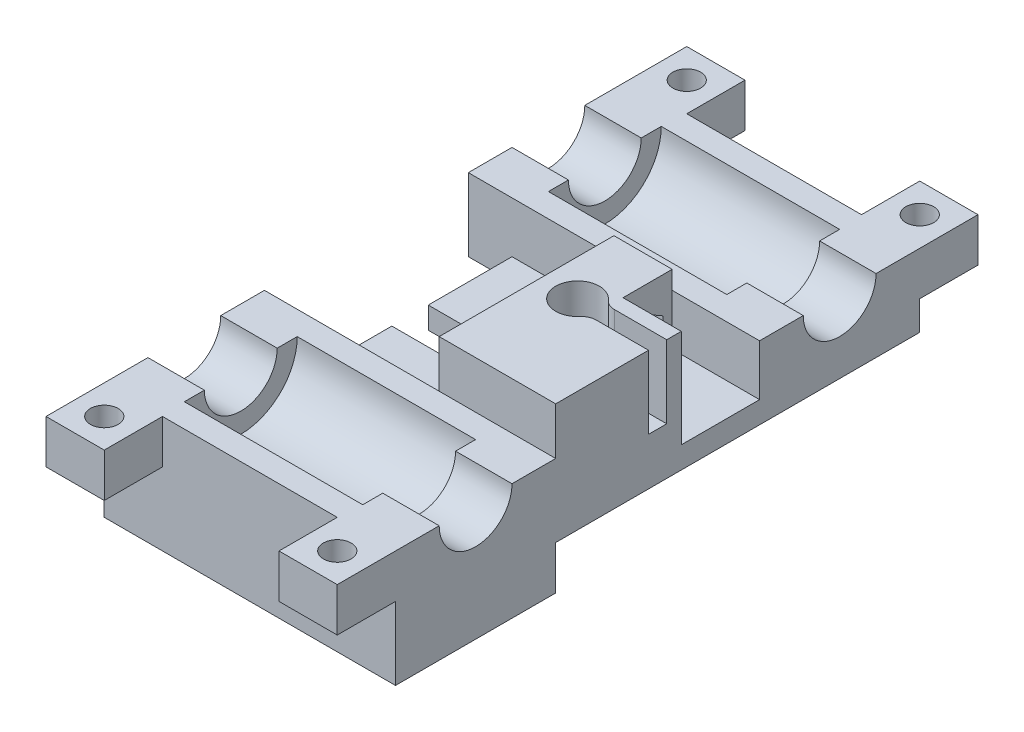
from build123d import *

# Parameters (mm, degrees)
SKETCH1_W                  = 40
SKETCH1_H                  = 22
BOSS_EXTRUDE1_DEPTH        = 11
SKETCH2_W                  = 40
SKETCH2_H                  = 22
SKETCH2_R                  = 4
BOSS_EXTRUDE2_DEPTH        = 5
SKETCH3_W                  = 24.5
SKETCH3_H                  = 15.5
CUT_EXTRUDE1_DEPTH         = 7.75
FILLET1_R                  = 7.75
SKETCH4_R                  = 5
CUT_EXTRUDE2_DEPTH         = 36.805900352
SKETCH5_W                  = 8
SKETCH5_H                  = 8
SKETCH5_R                  = 1.905800151
BOSS_EXTRUDE3_DEPTH        = 6
CUT_EXTRUDE3_START         = -3
SKETCH6_R                  = 3
SKETCH6_R_2                = 1.905800151
CUT_EXTRUDE3_DEPTH         = 3
SKETCH7_W                  = 16
SKETCH7_H                  = 16.5
BOSS_EXTRUDE5_DEPTH        = 28
MIRROR14_COPY_1_SKETCH_W   = 8
MIRROR14_COPY_1_SKETCH_H   = 8
MIRROR14_COPY_1_SKETCH_R   = 1.905800151
MIRROR14_COPY_1_DEPTH      = 6
MIRROR14_START             = -3
MIRROR14_COPY_2_SKETCH_R   = 3
MIRROR14_COPY_2_SKETCH_R_2 = 1.905800151
MIRROR14_COPY_2_DEPTH      = 3
FILLET1_OF_MIRROR14_R      = 7.75
SKETCH9_W                  = 28
SKETCH9_H                  = 3
BOSS_EXTRUDE6_DEPTH        = 18
CUT_EXTRUDE4_DEPTH         = 10
CUT_EXTRUDE5_DEPTH         = 73.919476136
CUT_EXTRUDE5_DEPTH_BACK    = 73.919476136
SKETCH11_R                 = 1.75
CUT_EXTRUDE6_DEPTH         = 76.121568141
CUT_EXTRUDE6_DEPTH_BACK    = 76.121568141
SKETCH12_R                 = 1.75
FILLET2_R                  = 2
CUT_EXTRUDE12_START        = -3
SKETCH17_R                 = 1.75
CUT_EXTRUDE12_DEPTH        = 3
CUT_EXTRUDE13_DEPTH        = 74.097537578
CUT_EXTRUDE13_DEPTH_BACK   = 74.097537578
SKETCH18_W                 = 18
SKETCH18_H                 = 5
FILLET3_R                  = 2.5
CUT_EXTRUDE14_DEPTH        = 74.710582687
CUT_EXTRUDE15_START        = -10
SKETCH21_R                 = 1.75
CUT_EXTRUDE15_DEPTH        = 10
SKETCH20_W                 = 36.163748027
SKETCH20_H                 = 4
CUT_EXTRUDE16_DEPTH        = 13.5
SKETCH22_W                 = 6.75
SKETCH22_H                 = 13.5
CUT_EXTRUDE18_DEPTH        = 8


with BuildPart() as part:
    # Sketch1 → Boss-Extrude1 (new body)
    with BuildSketch(Plane(origin=(0, 0, 0), x_dir=(1, 0, 0), z_dir=(0, 1, 0))):
        Rectangle(SKETCH1_W, SKETCH1_H)
    boss_extrude1 = extrude(amount=BOSS_EXTRUDE1_DEPTH)

    # Sketch2 → Boss-Extrude2 (add)
    with BuildSketch(Plane(origin=(0, 0, 0), x_dir=(1, 0, 0), z_dir=(0, 1, 0))):
        Rectangle(SKETCH2_W, SKETCH2_H)
        with Locations(Location((0, 0, 0), (0, 0, 270))):
            Circle(SKETCH2_R, mode=Mode.SUBTRACT)
    boss_extrude2 = extrude(amount=-BOSS_EXTRUDE2_DEPTH)

    # Sketch3 → Cut-Extrude1 (cut)
    with BuildSketch(Plane(origin=(0, 11, 0), x_dir=(1, 0, 0), z_dir=(0, 1, 0))):
        Rectangle(SKETCH3_W, SKETCH3_H)
    cut_extrude1 = extrude(amount=-CUT_EXTRUDE1_DEPTH, mode=Mode.SUBTRACT)

    # Fillet1
    fillet1_edges = [part.edges().sort_by_distance(p)[0] for p in [
        (0, 3.25, 7.75),
        (0, 3.25, -7.75),
    ]]
    fillet(fillet1_edges, radius=FILLET1_R - 0.0001)  # a hair under: the kernel refuses the full size

    # Sketch4 → Cut-Extrude2 (cut, symmetric)
    with BuildSketch(Plane(origin=(-12.25, 0, 0), x_dir=(0, 0, -1), z_dir=(1, 0, 0))):
        with Locations((0, 11)):
            Circle(SKETCH4_R)
    cut_extrude2 = extrude(amount=CUT_EXTRUDE2_DEPTH, both=True, mode=Mode.SUBTRACT)

    # Sketch5 → Boss-Extrude3 (add)
    with BuildSketch(Plane(origin=(0, 11, 0), x_dir=(1, 0, 0), z_dir=(0, 1, 0))):
        with Locations((16, -15)):
            Rectangle(SKETCH5_W, SKETCH5_H)
        with Locations(Location((16, -15, 0), (0, 0, 270))):
            Circle(SKETCH5_R, mode=Mode.SUBTRACT)
    boss_extrude3 = extrude(amount=-BOSS_EXTRUDE3_DEPTH)

    # Sketch6 → Cut-Extrude3 (cut)
    with BuildSketch(Plane.XZ.offset(-5).offset(CUT_EXTRUDE3_START)):
        with Locations(Location((16, 15, 0), (0, 0, 270))):
            Circle(SKETCH6_R)
        with Locations(Location((16, 15, 0), (0, 0, 90))):
            Circle(SKETCH6_R_2, mode=Mode.SUBTRACT)
    cut_extrude3 = extrude(amount=CUT_EXTRUDE3_DEPTH, mode=Mode.SUBTRACT)

    # Mirror8: Boss-Extrude3, Cut-Extrude3 across plane
    add(boss_extrude3.mirror(Plane(origin=(0, 0, 0), x_dir=(0, 0, 1), z_dir=(1, 0, 0))))
    add(cut_extrude3.mirror(Plane(origin=(0, 0, 0), x_dir=(0, 0, 1), z_dir=(1, 0, 0))), mode=Mode.SUBTRACT)

    # Sketch7 → Boss-Extrude5 (add)
    with BuildSketch(Plane(origin=(0, 0, -11), x_dir=(-1, 0, 0), z_dir=(0, 0, -1))):
        with Locations((-12, 9.25)):
            Rectangle(SKETCH7_W, SKETCH7_H)
    extrude(amount=BOSS_EXTRUDE5_DEPTH)

    # Mirror14: Boss-Extrude1, Boss-Extrude2, Cut-Extrude1, Cut-Extrude2, Boss-Extrude3, Cut-Extrude3 across plane
    add(boss_extrude1.mirror(Plane.XY.offset(-25)))
    add(boss_extrude2.mirror(Plane.XY.offset(-25)))
    add(cut_extrude1.mirror(Plane.XY.offset(-25)), mode=Mode.SUBTRACT)
    add(cut_extrude2.mirror(Plane.XY.offset(-25)), mode=Mode.SUBTRACT)
    add(boss_extrude3.mirror(Plane.XY.offset(-25)))
    add(cut_extrude3.mirror(Plane.XY.offset(-25)), mode=Mode.SUBTRACT)

    # Mirror14 copy 1 sketch → Mirror14 copy 1 (add)
    with BuildSketch(Plane(origin=(0, 11, -50), x_dir=(-1, 0, 0), z_dir=(0, 1, 0))):
        with Locations((16, -15)):
            Rectangle(MIRROR14_COPY_1_SKETCH_W, MIRROR14_COPY_1_SKETCH_H)
        with Locations(Location((16, -15, 0), (0, 0, 270))):
            Circle(MIRROR14_COPY_1_SKETCH_R, mode=Mode.SUBTRACT)
    extrude(amount=-MIRROR14_COPY_1_DEPTH)

    # Mirror14 copy 2 sketch → Mirror14 copy 2 (cut)
    with BuildSketch(Plane(origin=(0, 5, -50), x_dir=(-1, 0, 0), z_dir=(0, -1, 0)).offset(MIRROR14_START)):
        with Locations(Location((16, 15, 0), (0, 0, 270))):
            Circle(MIRROR14_COPY_2_SKETCH_R)
        with Locations(Location((16, 15, 0), (0, 0, 90))):
            Circle(MIRROR14_COPY_2_SKETCH_R_2, mode=Mode.SUBTRACT)
    extrude(amount=MIRROR14_COPY_2_DEPTH, mode=Mode.SUBTRACT)

    # Fillet1 of Mirror14
    fillet1_of_mirror14_edges = [part.edges().sort_by_distance(p)[0] for p in [
        (0, 3.25, -57.75),
        (0, 3.25, -42.25),
    ]]
    fillet(fillet1_of_mirror14_edges, radius=FILLET1_OF_MIRROR14_R - 0.0001)  # a hair under: the kernel refuses the full size

    # Sketch9 → Boss-Extrude6 (add)
    with BuildSketch(Plane.ZY.offset(-4)):
        with Locations((-25, 2.5)):
            Rectangle(SKETCH9_W, SKETCH9_H)
    extrude(amount=BOSS_EXTRUDE6_DEPTH)

    # Sketch10 → Cut-Extrude4 (cut)
    with BuildSketch(Plane(origin=(0, 17.5, 0), x_dir=(1, 0, 0), z_dir=(0, 1, 0))):
        with BuildLine():
            Line((9, 26.25), (9, 23.75))
            Line((9, 23.75), (11.727178029, 23.75))
            ThreePointArc((11.727178029, 23.75), (11.931001031, 24.360286817), (12, 25))
            ThreePointArc((12, 25), (11.931001031, 25.639713183), (11.727178029, 26.25))
            Line((11.727178029, 26.25), (9, 26.25))
        make_face()
        with BuildLine():
            Line((11.727178029, 23.75), (9, 23.75))
            Line((9, 23.75), (9, 26.25))
            Line((9, 26.25), (11.727178029, 26.25))
            ThreePointArc((11.727178029, 26.25), (6, 25), (11.727178029, 23.75))
        make_face()
        with BuildLine():
            ThreePointArc((12, 25), (11.931001031, 24.360286817), (11.727178029, 23.75))
            Line((11.727178029, 23.75), (20, 23.75))
            Line((20, 23.75), (20, 26.25))
            Line((20, 26.25), (11.727178029, 26.25))
            ThreePointArc((11.727178029, 26.25), (11.931001031, 25.639713183), (12, 25))
        make_face()
    extrude(amount=-CUT_EXTRUDE4_DEPTH, mode=Mode.SUBTRACT)

    # Sketch11 → Cut-Extrude5 (cut, two sides: drawn at the far end of the back side and taken through both)
    with BuildSketch(Plane(origin=(0, 7.5, 0), x_dir=(1, 0, 0), z_dir=(0, 1, 0)).offset(-CUT_EXTRUDE5_DEPTH_BACK)):
        with Locations(Location((9, 25, 0), (0, 0, 270))):
            Circle(SKETCH11_R)
    extrude(amount=CUT_EXTRUDE5_DEPTH + CUT_EXTRUDE5_DEPTH_BACK, mode=Mode.SUBTRACT)

    # Sketch12 → Cut-Extrude6 (cut, two sides: drawn at the far end of the back side and taken through both)
    with BuildSketch(Plane.ZY.offset(-4).offset(-CUT_EXTRUDE6_DEPTH_BACK)):
        with Locations((-31, 11)):
            Circle(SKETCH12_R)
    extrude(amount=CUT_EXTRUDE6_DEPTH + CUT_EXTRUDE6_DEPTH_BACK, mode=Mode.SUBTRACT)

    # Fillet2
    fillet2_edges = [part.edges().sort_by_distance(p)[0] for p in [
        (11.727178029, 12.5, -23.75),
        (11.727178029, 12.5, -26.25),
    ]]
    fillet(fillet2_edges, radius=FILLET2_R)

    # Sketch17 → Cut-Extrude12 (cut)
    with BuildSketch(Plane.XZ.offset(-1).offset(CUT_EXTRUDE12_START)):
        Polygon((12.175426481, -25), (10.58771324, -22.25), (7.41228676, -22.25), (5.824573519, -25), (7.41228676, -27.75), (10.58771324, -27.75), align=None)
        with Locations(Location((9, -25, 0), (0, 0, 90))):
            Circle(SKETCH17_R, mode=Mode.SUBTRACT)
    extrude(amount=CUT_EXTRUDE12_DEPTH, mode=Mode.SUBTRACT)

    # Sketch18 → Cut-Extrude13 (cut, two sides: drawn at the far end of the back side and taken through both)
    with BuildSketch(Plane(origin=(0, 4, 0), x_dir=(1, 0, 0), z_dir=(0, 1, 0)).offset(-CUT_EXTRUDE13_DEPTH_BACK)):
        with Locations((-5, 25)):
            Rectangle(SKETCH18_W, SKETCH18_H)
    extrude(amount=CUT_EXTRUDE13_DEPTH + CUT_EXTRUDE13_DEPTH_BACK, mode=Mode.SUBTRACT)

    # Fillet3
    fillet3_edges = [part.edges().sort_by_distance(p)[0] for p in [
        (4, 2.5, -27.5),
        (4, 2.5, -22.5),
    ]]
    fillet(fillet3_edges, radius=FILLET3_R - 0.0001)  # a hair under: the kernel refuses the full size

    # Sketch19 → Cut-Extrude14 (cut, through all)
    with BuildSketch(Plane.XZ.offset(-1)):
        Polygon((20, -61), (20, -39), (-14, -39), (-20, -39), (-20, -61), align=None)
    extrude(amount=CUT_EXTRUDE14_DEPTH, mode=Mode.SUBTRACT)

    # Sketch21 → Cut-Extrude15 (cut)
    with BuildSketch(Plane(origin=(20, 0, 0), x_dir=(0, 0, -1), z_dir=(1, 0, 0)).offset(CUT_EXTRUDE15_START)):
        Polygon((31, 14.175426481), (28.25, 12.58771324), (28.25, 9.41228676), (31, 7.824573519), (33.75, 9.41228676), (33.75, 12.58771324), align=None)
        with Locations((31, 11)):
            Circle(SKETCH21_R, mode=Mode.SUBTRACT)
    extrude(amount=CUT_EXTRUDE15_DEPTH, mode=Mode.SUBTRACT)

    # Sketch20 → Cut-Extrude16 (cut)
    with BuildSketch(Plane(origin=(0, 17.5, 0), x_dir=(1, 0, 0), z_dir=(0, 1, 0))):
        with Locations((22.081874014, 37)):
            Rectangle(SKETCH20_W, SKETCH20_H)
    extrude(amount=-CUT_EXTRUDE16_DEPTH, mode=Mode.SUBTRACT)

    # Sketch22 → Cut-Extrude18 (cut)
    with BuildSketch(Plane(origin=(20, 0, 0), x_dir=(0, 0, -1), z_dir=(1, 0, 0))):
        with Locations((31.625, 10.75)):
            Rectangle(SKETCH22_W, SKETCH22_H)
    extrude(amount=-CUT_EXTRUDE18_DEPTH, mode=Mode.SUBTRACT)


solid = part.part
